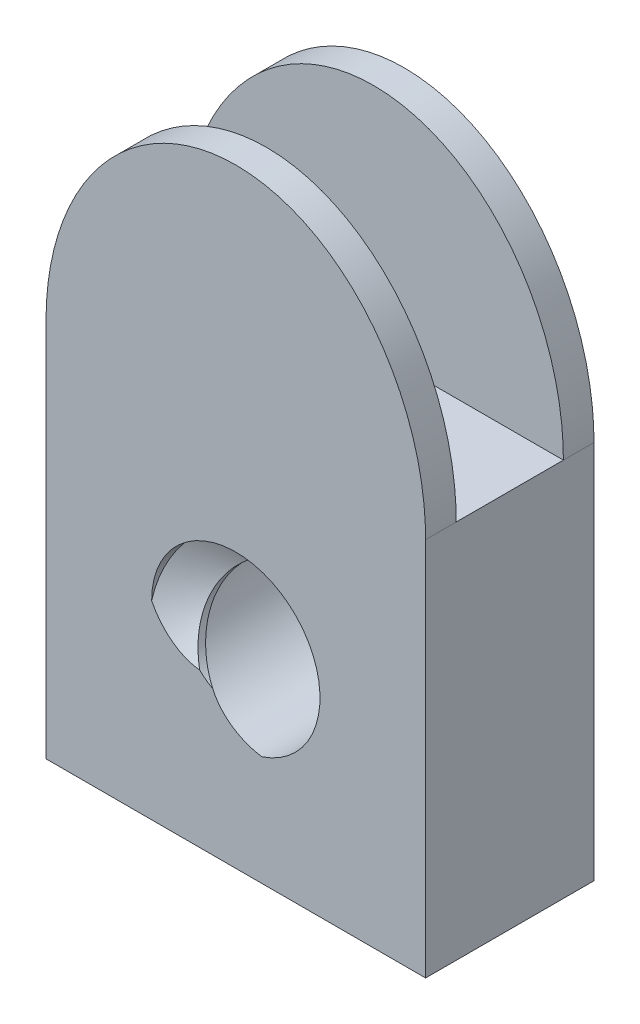
from build123d import *

# Parameters (mm, degrees)
SKETCH_1_W           = 24.8
SKETCH_1_H           = 24.8
EXTRUDE_1_DEPTH      = 11
HOLE_WIZARD_M10_1_D  = 11
EXTRUDE_3_DEPTH      = 11
SKETCH_9_W           = 24.8
SKETCH_9_H           = 7
CUT_EXTRUDE_12_DEPTH = 56.692230118
THREAD_1_PITCH       = 10
SKETCH_21_W          = 24.8
SKETCH_21_H          = 24.8
CUT_EXTRUDE_14_DEPTH = 71.437737536
SKETCH_22_W          = 24.8
SKETCH_22_H          = 24.8
CUT_EXTRUDE_15_DEPTH = 69.981654416


with BuildPart() as part:
    # Sketch 1 → ﾎﾞｽ - 押し出し1 (new body)
    with BuildSketch(Plane.XY):
        with Locations((-36.237274581, 20.264285714)):
            Rectangle(SKETCH_1_W, SKETCH_1_H)
    extrude(amount=EXTRUDE_1_DEPTH)

    # M10 すきまｽﾛｯﾄ1 (through all)
    with Locations(Plane(origin=(0, 0, 0), x_dir=(-1, 0, 0), z_dir=(0, 0, -1))):
        with Locations((36.237274581, 20.264285714)):
            Hole(HOLE_WIZARD_M10_1_D / 2)

    # ｽｹｯﾁ4 → ﾎﾞｽ - 押し出し3 (add)
    with BuildSketch(Plane(origin=(0, 0, 0), x_dir=(-1, 0, 0), z_dir=(0, 0, -1))):
        with BuildLine():
            Line((48.637274581, 32.664285714), (23.837274581, 32.664285714))
            add(Edge.make_bspline(
                [(48.637274581, 32.664285714), (48.637274581, 47.664285714), (36.237274581, 47.664285714), (23.837274581, 47.664285714), (23.837274581, 32.664285714)],
                knots=[4.71238898, 4.71238898, 4.71238898, 6.283185307, 6.283185307, 7.853981634, 7.853981634, 7.853981634], degree=2, weights=[1, 0.707106781, 1, 0.707106781, 1]))
        make_face()
    extrude(amount=-EXTRUDE_3_DEPTH)

    # ｽｹｯﾁ9 → ｶｯﾄ - 押し出し12 (cut, through all)
    with BuildSketch(Plane(origin=(0, 32.664285714, 0), x_dir=(1, 0, 0), z_dir=(0, 1, 0))):
        with Locations((-36.237274581, -5.5)):
            Rectangle(SKETCH_9_W, SKETCH_9_H)
    extrude(amount=CUT_EXTRUDE_12_DEPTH, mode=Mode.SUBTRACT)

    # ねじ山1: the profile of Sketch 1 2 profile screwed along a right-hand helix of 2.5 turns, 16 arcs to a turn; built about Z, then put on its axis
    thread_1_z = Axis((0, 0, 0), (0, 0, 1))
    thread_1_corners = [(5.5003, 0, -0.000173205), (3.3349365, 0, 1.249999995), (3.3349365, 0, 1.749999995), (5.5003, 0, 3.000173194)]
    with BuildLine(mode=Mode.PRIVATE) as thread_1_profile:
        Line(thread_1_corners[0], thread_1_corners[1])
        Line(thread_1_corners[1], thread_1_corners[2])
        Line(thread_1_corners[2], thread_1_corners[3])
        Line(thread_1_corners[3], thread_1_corners[0])
    thread_1_cap = Face(thread_1_profile.wire())
    thread_1_turn_angles = [0, 11.25, 22.5, 33.75, 45, 56.25, 67.5, 78.75, 90, 101.25, 112.5, 123.75, 135, 146.25, 157.5, 168.75, 180, 191.25, 202.5, 213.75, 225, 236.25, 247.5, 258.75, 270, 281.25, 292.5, 303.75, 315, 326.25, 337.5, 348.75, 360]
    thread_1_turn_weights = [1, 0.9807852804032304, 1, 0.9807852804032304, 1, 0.9807852804032304, 1, 0.9807852804032304, 1, 0.9807852804032304, 1, 0.9807852804032304, 1, 0.9807852804032304, 1, 0.9807852804032304, 1, 0.9807852804032304, 1, 0.9807852804032304, 1, 0.9807852804032304, 1, 0.9807852804032304, 1, 0.9807852804032304, 1, 0.9807852804032304, 1, 0.9807852804032304, 1, 0.9807852804032304, 1]
    thread_1_turn_rails = [Edge.make_bspline([Vector(p[0], p[1], 0).rotate(thread_1_z, thread_1_turn_angles[k]) / thread_1_turn_weights[k] + Vector(0, 0, p[2] + THREAD_1_PITCH * thread_1_turn_angles[k] / 360) for k in range(33)], [0, 0, 0, 1, 1, 2, 2, 3, 3, 4, 4, 5, 5, 6, 6, 7, 7, 8, 8, 9, 9, 10, 10, 11, 11, 12, 12, 13, 13, 14, 14, 15, 15, 16, 16, 16], 2, thread_1_turn_weights) for p in thread_1_corners]
    thread_1_turn_sides = [Face.make_surface_from_curves(thread_1_turn_rails[p[0]], thread_1_turn_rails[p[1]]) for p in [(0, 1), (1, 2), (2, 3), (3, 0)]]
    thread_1_last_angles = [720, 731.25, 742.5, 753.75, 765, 776.25, 787.5, 798.75, 810, 821.25, 832.5, 843.75, 855, 866.25, 877.5, 888.75, 900]
    thread_1_last_weights = [1, 0.9807852804032304, 1, 0.9807852804032304, 1, 0.9807852804032304, 1, 0.9807852804032304, 1, 0.9807852804032304, 1, 0.9807852804032304, 1, 0.9807852804032304, 1, 0.9807852804032304, 1]
    thread_1_last_rails = [Edge.make_bspline([Vector(p[0], p[1], 0).rotate(thread_1_z, thread_1_last_angles[k]) / thread_1_last_weights[k] + Vector(0, 0, p[2] + THREAD_1_PITCH * thread_1_last_angles[k] / 360) for k in range(17)], [0, 0, 0, 1, 1, 2, 2, 3, 3, 4, 4, 5, 5, 6, 6, 7, 7, 8, 8, 8], 2, thread_1_last_weights) for p in thread_1_corners]
    thread_1_last_sides = [Face.make_surface_from_curves(thread_1_last_rails[p[0]], thread_1_last_rails[p[1]]) for p in [(0, 1), (1, 2), (2, 3), (3, 0)]]
    thread_1 = Plane(origin=(-36.237274581, 20.264285714, 21), x_dir=(-1, 0, 0), z_dir=(0, 0, -1)) * Solid(Shell([*[p.moved(Location((0, 0, THREAD_1_PITCH * i))) for i in range(2) for p in thread_1_turn_sides], *thread_1_last_sides, thread_1_cap, thread_1_cap.rotate(thread_1_z, 900).moved(Location((0, 0, THREAD_1_PITCH * 900 / 360)))]))
    add(thread_1)

    # ｽｹｯﾁ21 → ｶｯﾄ - 押し出し14 (cut, through all)
    with BuildSketch(Plane.XY.offset(11)):
        with Locations((-36.237274581, 20.264285714)):
            Rectangle(SKETCH_21_W, SKETCH_21_H)
    extrude(amount=CUT_EXTRUDE_14_DEPTH, mode=Mode.SUBTRACT)

    # ｽｹｯﾁ22 → ｶｯﾄ - 押し出し15 (cut, through all)
    with BuildSketch(Plane(origin=(0, 0, 0), x_dir=(-1, 0, 0), z_dir=(0, 0, -1))):
        with Locations((36.237274581, 20.264285714)):
            Rectangle(SKETCH_22_W, SKETCH_22_H)
    extrude(amount=CUT_EXTRUDE_15_DEPTH, mode=Mode.SUBTRACT)


solid = part.part
